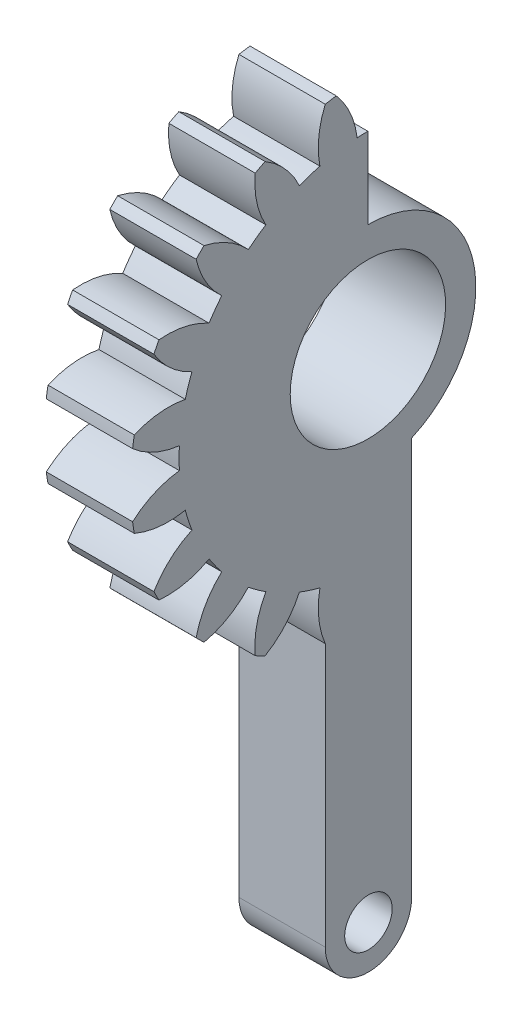
from build123d import *

# Parameters (mm, degrees)
BASPROSKE_W         = 4
BASPROSKE_H         = 11
TOOTHCUT_DEPTH      = 17.062378404
TEETHCUTS_COUNT     = 20
TEETHCUTS_ANGLE     = 342
BORSKE_R            = 1
BORE_DEPTH          = 50.0000508
CUT_EXTRUDE_1_DEPTH = 10
EXTRUDE_1_REACH     = 39.733
SKETCH_3_W          = 4
SKETCH_3_H          = 4
FILLET_1_R          = 2
SKETCH_4_R          = 1.1
CUT_EXTRUDE_2_DEPTH = 10
EXTRUDE_START       = -4
SKETCH_5_R          = 1
EXTRUDE_2_DEPTH     = 4
EXTRUDE_3_DEPTH     = 1
EXTRUDE_START_2     = 4
EXTRUDE_4_DEPTH     = 4
SKETCH_8_R          = 3.6
CUT_EXTRUDE_3_DEPTH = 3.2
CUT_EXTRUDE_START   = -23.2
SKETCH_10_R         = 3.6
CUT_EXTRUDE_4_DEPTH = 23.2
SKETCH_11_R         = 3.6
EXTRUDE_5_DEPTH     = 1
CUT_EXTRUDE_START_2 = -1
SKETCH_12_R         = 3.6
CUT_EXTRUDE_5_DEPTH = 1
CUT_EXTRUDE_START_3 = -1.8
CUT_EXTRUDE_6_DEPTH = 1.8


with BuildPart() as part:
    # BasProSke → Base-Revolve (revolve)
    with BuildSketch(Plane(origin=(0, 0, 0), x_dir=(1, 0, 0), z_dir=(0, 1, 0)), mode=Mode.PRIVATE) as base_revolve_sk:
        with Locations((2, 5.5)):
            Rectangle(BASPROSKE_W, BASPROSKE_H)
    revolve(base_revolve_sk.sketch.rotate(Axis((-10, 0, 0), (1, 0, 0)), 180), axis=Axis((-10, 0, 0), (1, 0, 0)))

    # TooCutSke → ToothCut (cut, through all)
    with BuildSketch(Plane(origin=(0, 0, 0), x_dir=(0, 0, -1), z_dir=(1, 0, 0))):
        with BuildLine():
            ThreePointArc((0.499924007, 8.734705318), (0, 8.749), (-0.499924007, 8.734705318))
            ThreePointArc((-0.499924007, 8.734705318), (-0.824302243, 9.905497836), (-1.485192705, 10.924909509))
            ThreePointArc((-1.485192705, 10.924909509), (0, 11.0254), (1.485192705, 10.924909509))
            ThreePointArc((1.485192705, 10.924909509), (0.824302243, 9.905497836), (0.499924007, 8.734705318))
        make_face()
    toothcut = extrude(amount=TOOTHCUT_DEPTH, mode=Mode.SUBTRACT)

    # TeethCuts: ToothCut ×20 about axis
    teethcuts_axis = Axis((-10, 0, 0), (1, 0, 0))
    for i in range(1, TEETHCUTS_COUNT):
        add(toothcut.rotate(teethcuts_axis, i * TEETHCUTS_ANGLE / (TEETHCUTS_COUNT - 1)), mode=Mode.SUBTRACT)

    # BorSke → Bore (cut, symmetric)
    with BuildSketch(Plane(origin=(0, 0, 0), x_dir=(0, 0, -1), z_dir=(1, 0, 0))):
        with Locations(Location((0, 0, 0), (0, 0, 180))):
            Circle(BORSKE_R)
    extrude(amount=BORE_DEPTH, both=True, mode=Mode.SUBTRACT)

    # 草图1 → 切除-拉伸1 (cut)
    with BuildSketch(Plane(origin=(4, 0, 0), x_dir=(0, 0, -1), z_dir=(1, 0, 0))):
        with BuildLine():
            Line((0, 12.401538845), (0, 2.5))
            ThreePointArc((0, 2.5), (1.767766953, 1.767766953), (2.5, 0))
            ThreePointArc((2.5, 0), (1.767766953, -1.767766953), (0, -2.5))
            Line((0, -2.5), (0, -15.030002789))
            Line((0, -15.030002789), (15.193341894, -15.030002789))
            Line((15.193341894, -15.030002789), (15.193341894, 12.401538845))
            Line((15.193341894, 12.401538845), (0, 12.401538845))
        make_face()
    extrude(amount=-CUT_EXTRUDE_1_DEPTH, mode=Mode.SUBTRACT)

    # 草图3 → 凸台-拉伸1 (add, up to next)
    with BuildSketch(Plane(origin=(0, -25, 0), x_dir=(1, 0, 0), z_dir=(0, 1, 0)), mode=Mode.PRIVATE) as extrude_1_sk1:
        with Locations((2, 0.024348859)):
            Rectangle(SKETCH_3_W, SKETCH_3_H)
    extrude_1_tool1 = extrude(extrude_1_sk1.sketch, amount=EXTRUDE_1_REACH, mode=Mode.PRIVATE) - part.part
    add(extrude_1_tool1.solids().sort_by_distance((2, -25, -0.024349))[0])

    # 圆角1
    fillet_1_edges = [part.edges().sort_by_distance(p)[0] for p in [
        (2, -25, 1.975651141),
        (2, -25, -2.024348859),
    ]]
    fillet(fillet_1_edges, radius=FILLET_1_R - 0.0001)  # a hair under: the kernel refuses the full size

    # 草图4 → 切除-拉伸2 (cut)
    with BuildSketch(Plane(origin=(4, 0, 0), x_dir=(0, 0, -1), z_dir=(1, 0, 0))):
        with Locations((0.024348859, -23)):
            Circle(SKETCH_4_R)
    extrude(amount=-CUT_EXTRUDE_2_DEPTH, mode=Mode.SUBTRACT)

    # 草图5 → 凸台-拉伸2 (add)
    with BuildSketch(Plane.ZY.offset(EXTRUDE_START)):
        Circle(SKETCH_5_R)
    extrude(amount=EXTRUDE_2_DEPTH)

    # 草图6 → 凸台-拉伸3 (add)
    with BuildSketch(Plane.ZY):
        with BuildLine():
            Line((0, 5), (0, 2.5))
            ThreePointArc((0, 2.5), (-2.226817699, 1.136346309), (-2.024348859, -1.466973653))
            Line((-2.024348859, -1.466973653), (-2.024348859, -4.571871794))
            ThreePointArc((-2.024348859, -4.571871794), (2.727476463, -4.19056943), (5, 0))
            ThreePointArc((5, 0), (3.535533906, 3.535533906), (0, 5))
        make_face()
        with BuildLine():
            ThreePointArc((-2.024348859, -1.466973653), (-2.226817699, 1.136346309), (0, 2.5))
            Line((0, 2.5), (0, 5))
            ThreePointArc((0, 5), (-4.891797163, 1.034562959), (-2.024348859, -4.571871794))
            Line((-2.024348859, -4.571871794), (-2.024348859, -1.466973653))
        make_face()
        with BuildLine():
            Line((0, 5), (0, 2.5))
            ThreePointArc((0, 2.5), (-2.226817699, 1.136346309), (-2.024348859, -1.466973653))
            Line((-2.024348859, -1.466973653), (-2.024348859, -4.571871794))
            ThreePointArc((-2.024348859, -4.571871794), (2.727476463, -4.19056943), (5, 0))
            ThreePointArc((5, 0), (3.535533906, 3.535533906), (0, 5))
        make_face()
        with BuildLine():
            ThreePointArc((-2.024348859, -1.466973653), (-2.226817699, 1.136346309), (0, 2.5))
            Line((0, 2.5), (0, 5))
            ThreePointArc((0, 5), (-4.891797163, 1.034562959), (-2.024348859, -4.571871794))
            Line((-2.024348859, -4.571871794), (-2.024348859, -1.466973653))
        make_face()
    extrude(amount=EXTRUDE_3_DEPTH)

    # 草图7 → 凸台-拉伸4 (add)
    with BuildSketch(Plane(origin=(0, 0, 0), x_dir=(0, 0, -1), z_dir=(1, 0, 0)).offset(EXTRUDE_START_2)):
        with BuildLine():
            Line((0, 5), (0, 2.5))
            ThreePointArc((0, 2.5), (2.226817699, 1.136346309), (2.024348859, -1.466973653))
            Line((2.024348859, -1.466973653), (2.024348859, -4.571871794))
            ThreePointArc((2.024348859, -4.571871794), (4.891797163, 1.034562959), (0, 5))
        make_face()
    extrude(amount=-EXTRUDE_4_DEPTH)

    # 草图8 → 切除-拉伸3 (cut)
    with BuildSketch(Plane(origin=(4, 0, 0), x_dir=(0, 0, -1), z_dir=(1, 0, 0))):
        Circle(SKETCH_8_R)
    extrude(amount=-CUT_EXTRUDE_3_DEPTH, mode=Mode.SUBTRACT)

    # 草图10 → 切除-拉伸4 (cut)
    with BuildSketch(Plane.ZY.offset(1).offset(CUT_EXTRUDE_START)):
        with Locations(Location((0, 0, 0), (0, 0, 180))):
            Circle(SKETCH_10_R)
    extrude(amount=CUT_EXTRUDE_4_DEPTH, mode=Mode.SUBTRACT)

    # 草图11 → 凸台-拉伸5 (add)
    with BuildSketch(Plane(origin=(4, 0, 0), x_dir=(0, 0, -1), z_dir=(1, 0, 0))):
        Circle(SKETCH_11_R)
    extrude(amount=-EXTRUDE_5_DEPTH)

    # 草图12 → 切除-拉伸5 (cut)
    with BuildSketch(Plane.ZY.offset(-3).offset(CUT_EXTRUDE_START_2)):
        Circle(SKETCH_12_R)
    extrude(amount=CUT_EXTRUDE_5_DEPTH, mode=Mode.SUBTRACT)

    # 草图13 → 切除-拉伸6 (cut)
    with BuildSketch(Plane.ZY.offset(1).offset(CUT_EXTRUDE_START_3)):
        with BuildLine():
            Line((6, 2.564298292), (2.227527106, 2.828095294))
            ThreePointArc((2.227527106, 2.828095294), (3.6, 0), (2.227527106, -2.828095294))
            Line((2.227527106, -2.828095294), (6, -2.564298292))
            Line((6, -2.564298292), (6, 2.564298292))
        make_face()
    extrude(amount=CUT_EXTRUDE_6_DEPTH, mode=Mode.SUBTRACT)


solid = part.part
